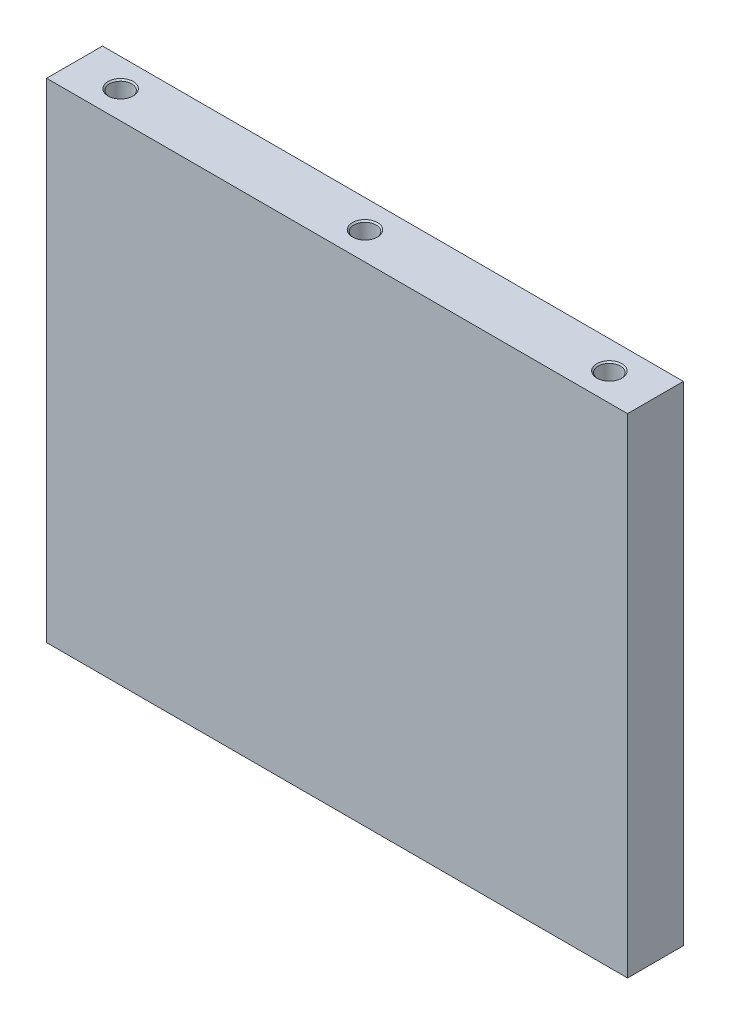
from build123d import *

# Parameters (mm, degrees)
SKETCH1_W           = 208
SKETCH1_H           = 20
BOSS_EXTRUDE1_DEPTH = 175
SKETCH2_R           = 4
CUT_EXTRUDE1_DEPTH  = 12
CHAMFER1_SIZE       = 0.5


with BuildPart() as part:
    # Sketch1 → Boss-Extrude1 (new body)
    with BuildSketch(Plane(origin=(0, 0, -58), x_dir=(1, 0, 0), z_dir=(0, 1, 0))):
        with Locations((0, -58)):
            Rectangle(SKETCH1_W, SKETCH1_H)
    extrude(amount=BOSS_EXTRUDE1_DEPTH)

    # Sketch2 → Cut-Extrude1 (cut)
    with BuildSketch(Plane(origin=(0, 175, 0), x_dir=(1, 0, 0), z_dir=(0, 1, 0))):
        Circle(SKETCH2_R)
        with Locations((-87.5, 0)):
            Circle(SKETCH2_R)
        with Locations((87.5, 0)):
            Circle(SKETCH2_R)
    cut_extrude1 = extrude(amount=-CUT_EXTRUDE1_DEPTH, mode=Mode.SUBTRACT)

    # Mirror6: Cut-Extrude1 across plane
    add(cut_extrude1.mirror(Plane.ZX.offset(87.5)), mode=Mode.SUBTRACT)

    # Chamfer1
    chamfer1_edges = [part.edges().sort_by_distance(p)[0] for p in [
        (83.5, 175, 0),
        (-4, 175, 0),
        (-91.5, 175, 0),
        (-91.5, 0, 0),
        (-4, 0, 0),
        (83.5, 0, 0),
    ]]
    chamfer(chamfer1_edges, length=CHAMFER1_SIZE)


solid = part.part
